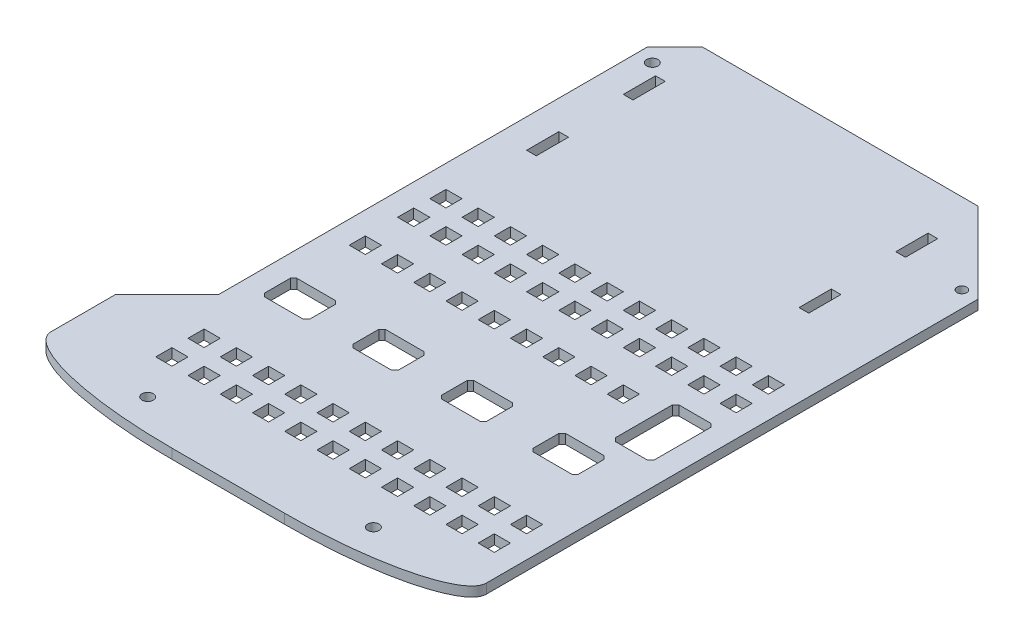
from build123d import *

# Parameters (mm, degrees)
SKETCH2_W           = 135
SKETCH2_H           = 190
BOSS_EXTRUDE2_DEPTH = 3
FILLET1_SIZE        = 50
FILLET1_SIZE_2      = 12.5
FILLET2_SIZE        = 12.5
FILLET2_SIZE_2      = 50
SKETCH6_R           = 1.75
CUT_EXTRUDE4_DEPTH  = 10
CUT_EXTRUDE5_DEPTH  = 117.577227764
SKETCH8_W           = 14
SKETCH8_H           = 10
CUT_EXTRUDE6_DEPTH  = 117.577227764
CHAMFER1_SIZE       = 1
CHAMFER2_SIZE       = 1
SKETCH9_W           = 12
SKETCH9_H           = 19.7
CUT_EXTRUDE7_DEPTH  = 117.577227764
CHAMFER3_SIZE       = 1
CHAMFER4_SIZE       = 25
SKETCH11_W          = 3
SKETCH11_H          = 10
CUT_EXTRUDE9_DEPTH  = 117.577227764
SKETCH12_W          = 5
SKETCH12_H          = 5
CUT_EXTRUDE10_DEPTH = 117.577227764
SKETCH13_W          = 5
SKETCH13_H          = 5
CUT_EXTRUDE11_DEPTH = 117.577227764
SKETCH14_R          = 1.5
SKETCH14_R_2        = 1.75
CUT_EXTRUDE12_DEPTH = 10


with BuildPart() as part:
    # Sketch2 → Boss-Extrude2 (new body)
    with BuildSketch(Plane(origin=(0, 0, 0), x_dir=(1, 0, 0), z_dir=(0, 1, 0))):
        Rectangle(SKETCH2_W, SKETCH2_H)
    extrude(amount=BOSS_EXTRUDE2_DEPTH)

    # Fillet1
    # an asymmetric fillet: 50, 12.5 mm, written as the material it takes off along each edge
    with BuildSketch(Plane(origin=(-67.5, -125, 95), x_dir=(1, 0, 0), z_dir=(0, 1, 0))) as fillet1_piece_1:
        with BuildLine():
            Bezier((FILLET1_SIZE, 0), (0, 0), (0, FILLET1_SIZE_2), weights=[1, 0.707106781, 1])
            Line((0, FILLET1_SIZE_2), (0, 0))
            Line((0, 0), (FILLET1_SIZE, 0))
        make_face()
    extrude(amount=253, mode=Mode.SUBTRACT)

    # Fillet2
    # an asymmetric fillet: 50, 12.5 mm, written as the material it takes off along each edge
    with BuildSketch(Plane(origin=(67.5, -125, 95), x_dir=(0, 0, -1), z_dir=(0, 1, 0))) as fillet2_piece_1:
        with BuildLine():
            Bezier((FILLET2_SIZE, 0), (0, 0), (0, FILLET2_SIZE_2), weights=[1, 0.707106781, 1])
            Line((0, FILLET2_SIZE_2), (0, 0))
            Line((0, 0), (FILLET2_SIZE, 0))
        make_face()
    extrude(amount=253, mode=Mode.SUBTRACT)

    # Sketch6 → Cut-Extrude4 (cut)
    with BuildSketch(Plane(origin=(0, 3, 0), x_dir=(1, 0, 0), z_dir=(0, 1, 0))):
        with Locations(Location((35, -85, 0), (0, 0, 270))):
            Circle(SKETCH6_R)
        with Locations(Location((-35, -85, 0), (0, 0, 270))):
            Circle(SKETCH6_R)
    extrude(amount=-CUT_EXTRUDE4_DEPTH, mode=Mode.SUBTRACT)

    # Sketch7 → Cut-Extrude5 (cut, through all)
    with BuildSketch(Plane(origin=(0, 3, 0), x_dir=(1, 0, 0), z_dir=(0, 1, 0))):
        Polygon((-51.5, 86.514718626), (-51.5, -46.5), (-67.5, -62.5), (-67.5, 95), (-43.014718626, 95), align=None)
    extrude(amount=-CUT_EXTRUDE5_DEPTH, mode=Mode.SUBTRACT)

    # Sketch8 → Cut-Extrude6 (cut, through all)
    with BuildSketch(Plane(origin=(0, 3, 0), x_dir=(1, 0, 0), z_dir=(0, 1, 0))):
        with Locations((-37.77, -35)):
            Rectangle(SKETCH8_W, SKETCH8_H)
        with Locations((-10.33, -35)):
            Rectangle(SKETCH8_W, SKETCH8_H)
        with Locations((17.11, -35)):
            Rectangle(SKETCH8_W, SKETCH8_H)
        with Locations((45.55, -35)):
            Rectangle(SKETCH8_W, SKETCH8_H)
    extrude(amount=-CUT_EXTRUDE6_DEPTH, mode=Mode.SUBTRACT)

    # Chamfer1
    chamfer1_edges = [part.edges().sort_by_distance(p)[0] for p in [
        (-30.77, 1.5, 30),
        (-30.77, 1.5, 40),
        (-44.77, 1.5, 40),
        (-44.77, 1.5, 30),
    ]]
    chamfer(chamfer1_edges, length=CHAMFER1_SIZE)

    # Chamfer2
    chamfer2_edges = [part.edges().sort_by_distance(p)[0] for p in [
        (-17.33, 1.5, 40),
        (-17.33, 1.5, 30),
        (-3.33, 1.5, 30),
        (-3.33, 1.5, 40),
        (38.55, 1.5, 40),
        (38.55, 1.5, 30),
        (52.55, 1.5, 30),
        (52.55, 1.5, 40),
        (10.11, 1.5, 40),
        (10.11, 1.5, 30),
        (24.11, 1.5, 30),
        (24.11, 1.5, 40),
    ]]
    chamfer(chamfer2_edges, length=CHAMFER2_SIZE)

    # Sketch9 → Cut-Extrude7 (cut, through all)
    with BuildSketch(Plane(origin=(0, 3, 0), x_dir=(1, 0, 0), z_dir=(0, 1, 0))):
        with Locations((54.48, -14.62)):
            Rectangle(SKETCH9_W, SKETCH9_H)
    extrude(amount=-CUT_EXTRUDE7_DEPTH, mode=Mode.SUBTRACT)

    # Chamfer3
    chamfer3_edges = [part.edges().sort_by_distance(p)[0] for p in [
        (60.48, 1.5, 4.77),
        (60.48, 1.5, 24.47),
        (48.48, 1.5, 24.47),
        (48.48, 1.5, 4.77),
    ]]
    chamfer(chamfer3_edges, length=CHAMFER3_SIZE)

    # Chamfer4
    chamfer4_edges = [part.edges().sort_by_distance(p)[0] for p in [
        (67.5, 1.5, -95),
    ]]
    chamfer(chamfer4_edges, length=CHAMFER4_SIZE)

    # Sketch11 → Cut-Extrude9 (cut, through all)
    with BuildSketch(Plane(origin=(0, 3, 0), x_dir=(1, 0, 0), z_dir=(0, 1, 0))):
        with Locations((-41, 45)):
            Rectangle(SKETCH11_W, SKETCH11_H)
        with Locations((-41, 75)):
            Rectangle(SKETCH11_W, SKETCH11_H)
        with Locations((43.5, 75)):
            Rectangle(SKETCH11_W, SKETCH11_H)
        with Locations((43.5, 45)):
            Rectangle(SKETCH11_W, SKETCH11_H)
    extrude(amount=-CUT_EXTRUDE9_DEPTH, mode=Mode.SUBTRACT)

    # Sketch12 → Cut-Extrude10 (cut, through all)
    with BuildSketch(Plane(origin=(0, 3, 0), x_dir=(1, 0, 0), z_dir=(0, 1, 0))):
        with Locations((-42, 14.5)):
            Rectangle(SKETCH12_W, SKETCH12_H)
        with Locations((-32, 14.5)):
            Rectangle(SKETCH12_W, SKETCH12_H)
        with Locations((-22, 14.5)):
            Rectangle(SKETCH12_W, SKETCH12_H)
        with Locations((-12, 14.5)):
            Rectangle(SKETCH12_W, SKETCH12_H)
        with Locations((-2, 14.5)):
            Rectangle(SKETCH12_W, SKETCH12_H)
        with Locations((8, 14.5)):
            Rectangle(SKETCH12_W, SKETCH12_H)
        with Locations((18, 14.5)):
            Rectangle(SKETCH12_W, SKETCH12_H)
        with Locations((28, 14.5)):
            Rectangle(SKETCH12_W, SKETCH12_H)
        with Locations((38, 14.5)):
            Rectangle(SKETCH12_W, SKETCH12_H)
        with Locations((48, 14.5)):
            Rectangle(SKETCH12_W, SKETCH12_H)
        with Locations((58, 14.5)):
            Rectangle(SKETCH12_W, SKETCH12_H)
        with Locations((-32, -10.5)):
            Rectangle(SKETCH12_W, SKETCH12_H)
        with Locations((-22, -10.5)):
            Rectangle(SKETCH12_W, SKETCH12_H)
        with Locations((-12, -10.5)):
            Rectangle(SKETCH12_W, SKETCH12_H)
        with Locations((-2, -10.5)):
            Rectangle(SKETCH12_W, SKETCH12_H)
        with Locations((8, -10.5)):
            Rectangle(SKETCH12_W, SKETCH12_H)
        with Locations((18, -10.5)):
            Rectangle(SKETCH12_W, SKETCH12_H)
        with Locations((28, -10.5)):
            Rectangle(SKETCH12_W, SKETCH12_H)
        with Locations((38, -10.5)):
            Rectangle(SKETCH12_W, SKETCH12_H)
        with Locations((-32, -60.5)):
            Rectangle(SKETCH12_W, SKETCH12_H)
        with Locations((-22, -60.5)):
            Rectangle(SKETCH12_W, SKETCH12_H)
        with Locations((-12, -60.5)):
            Rectangle(SKETCH12_W, SKETCH12_H)
        with Locations((-2, -60.5)):
            Rectangle(SKETCH12_W, SKETCH12_H)
        with Locations((8, -60.5)):
            Rectangle(SKETCH12_W, SKETCH12_H)
        with Locations((18, -60.5)):
            Rectangle(SKETCH12_W, SKETCH12_H)
        with Locations((28, -60.5)):
            Rectangle(SKETCH12_W, SKETCH12_H)
        with Locations((38, -60.5)):
            Rectangle(SKETCH12_W, SKETCH12_H)
        with Locations((48, -60.5)):
            Rectangle(SKETCH12_W, SKETCH12_H)
        with Locations((58, -60.5)):
            Rectangle(SKETCH12_W, SKETCH12_H)
        with Locations((-42, -10.5)):
            Rectangle(SKETCH12_W, SKETCH12_H)
        with Locations((-42, -60.5)):
            Rectangle(SKETCH12_W, SKETCH12_H)
    extrude(amount=-CUT_EXTRUDE10_DEPTH, mode=Mode.SUBTRACT)

    # Sketch13 → Cut-Extrude11 (cut, through all)
    with BuildSketch(Plane(origin=(0, 3, 0), x_dir=(1, 0, 0), z_dir=(0, 1, 0))):
        with Locations((-42, -70.5)):
            Rectangle(SKETCH13_W, SKETCH13_H)
        with Locations((-32, -70.5)):
            Rectangle(SKETCH13_W, SKETCH13_H)
        with Locations((-22, -70.5)):
            Rectangle(SKETCH13_W, SKETCH13_H)
        with Locations((-12, -70.5)):
            Rectangle(SKETCH13_W, SKETCH13_H)
        with Locations((-2, -70.5)):
            Rectangle(SKETCH13_W, SKETCH13_H)
        with Locations((8, -70.5)):
            Rectangle(SKETCH13_W, SKETCH13_H)
        with Locations((18, -70.5)):
            Rectangle(SKETCH13_W, SKETCH13_H)
        with Locations((28, -70.5)):
            Rectangle(SKETCH13_W, SKETCH13_H)
        with Locations((38, -70.5)):
            Rectangle(SKETCH13_W, SKETCH13_H)
        with Locations((48, -70.5)):
            Rectangle(SKETCH13_W, SKETCH13_H)
        with Locations((58, -70.5)):
            Rectangle(SKETCH13_W, SKETCH13_H)
        with Locations((-32, 4.5)):
            Rectangle(SKETCH13_W, SKETCH13_H)
        with Locations((-42, 4.5)):
            Rectangle(SKETCH13_W, SKETCH13_H)
        with Locations((-22, 4.5)):
            Rectangle(SKETCH13_W, SKETCH13_H)
        with Locations((-12, 4.5)):
            Rectangle(SKETCH13_W, SKETCH13_H)
        with Locations((-2, 4.5)):
            Rectangle(SKETCH13_W, SKETCH13_H)
        with Locations((8, 4.5)):
            Rectangle(SKETCH13_W, SKETCH13_H)
        with Locations((18, 4.5)):
            Rectangle(SKETCH13_W, SKETCH13_H)
        with Locations((28, 4.5)):
            Rectangle(SKETCH13_W, SKETCH13_H)
        with Locations((38, 4.5)):
            Rectangle(SKETCH13_W, SKETCH13_H)
        with Locations((48, 4.5)):
            Rectangle(SKETCH13_W, SKETCH13_H)
        with Locations((58, 4.5)):
            Rectangle(SKETCH13_W, SKETCH13_H)
    extrude(amount=-CUT_EXTRUDE11_DEPTH, mode=Mode.SUBTRACT)

    # Sketch14 → Cut-Extrude12 (cut)
    with BuildSketch(Plane(origin=(0, 3, 0), x_dir=(1, 0, 0), z_dir=(0, 1, 0))):
        with Locations(Location((62.5, 70, 0), (0, 0, 270))):
            Circle(SKETCH14_R)
        with Locations(Location((-46.514718626, 83, 0), (0, 0, 270))):
            Circle(SKETCH14_R_2)
    extrude(amount=-CUT_EXTRUDE12_DEPTH, mode=Mode.SUBTRACT)


solid = part.part
